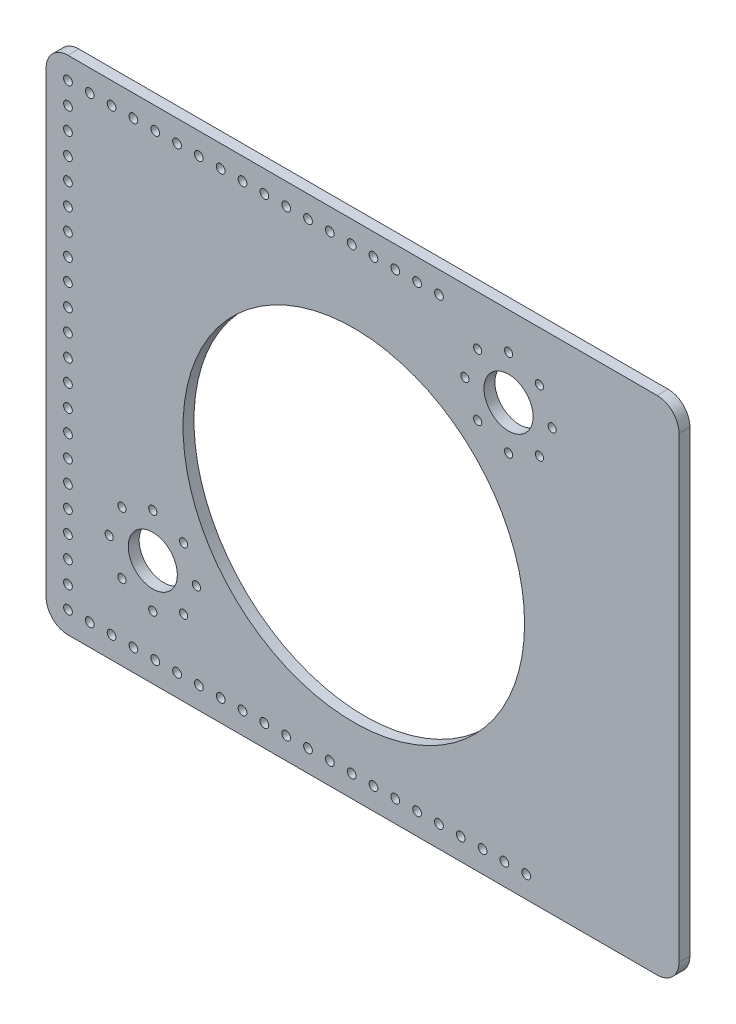
from build123d import *

# Parameters (mm, degrees)
SKETCH1_W           = 368.3
SKETCH1_H           = 292.1
SKETCH1_R           = 99.3775
SKETCH1_R_2         = 2.54
BOSS_EXTRUDE1_DEPTH = 6.35
SKETCH2_R           = 14.2875
SKETCH2_R_2         = 2.38125
CUT_EXTRUDE1_DEPTH  = 471.11447808
FILLET1_R           = 12.7


with BuildPart() as part:
    # Sketch1 → Boss-Extrude1 (new body)
    with BuildSketch(Plane.XY):
        with Locations((184.15, 146.05)):
            Rectangle(SKETCH1_W, SKETCH1_H)
        with Locations((179.07, 138.43)):
            Circle(SKETCH1_R, mode=Mode.SUBTRACT)
        with Locations((12.7, 279.4)):
            Circle(SKETCH1_R_2, mode=Mode.SUBTRACT)
        with Locations((25.4, 279.4)):
            Circle(SKETCH1_R_2, mode=Mode.SUBTRACT)
        with Locations((38.1, 279.4)):
            Circle(SKETCH1_R_2, mode=Mode.SUBTRACT)
        with Locations((50.8, 279.4)):
            Circle(SKETCH1_R_2, mode=Mode.SUBTRACT)
        with Locations((63.5, 279.4)):
            Circle(SKETCH1_R_2, mode=Mode.SUBTRACT)
        with Locations((76.2, 279.4)):
            Circle(SKETCH1_R_2, mode=Mode.SUBTRACT)
        with Locations((88.9, 279.4)):
            Circle(SKETCH1_R_2, mode=Mode.SUBTRACT)
        with Locations((101.6, 279.4)):
            Circle(SKETCH1_R_2, mode=Mode.SUBTRACT)
        with Locations((114.3, 279.4)):
            Circle(SKETCH1_R_2, mode=Mode.SUBTRACT)
        with Locations((127, 279.4)):
            Circle(SKETCH1_R_2, mode=Mode.SUBTRACT)
        with Locations((139.7, 279.4)):
            Circle(SKETCH1_R_2, mode=Mode.SUBTRACT)
        with Locations((152.4, 279.4)):
            Circle(SKETCH1_R_2, mode=Mode.SUBTRACT)
        with Locations((165.1, 279.4)):
            Circle(SKETCH1_R_2, mode=Mode.SUBTRACT)
        with Locations((177.8, 279.4)):
            Circle(SKETCH1_R_2, mode=Mode.SUBTRACT)
        with Locations((190.5, 279.4)):
            Circle(SKETCH1_R_2, mode=Mode.SUBTRACT)
        with Locations((203.2, 279.4)):
            Circle(SKETCH1_R_2, mode=Mode.SUBTRACT)
        with Locations((215.9, 279.4)):
            Circle(SKETCH1_R_2, mode=Mode.SUBTRACT)
        with Locations((228.6, 279.4)):
            Circle(SKETCH1_R_2, mode=Mode.SUBTRACT)
        with Locations((12.7, 266.7)):
            Circle(SKETCH1_R_2, mode=Mode.SUBTRACT)
        with Locations((12.7, 254)):
            Circle(SKETCH1_R_2, mode=Mode.SUBTRACT)
        with Locations((12.7, 241.3)):
            Circle(SKETCH1_R_2, mode=Mode.SUBTRACT)
        with Locations((12.7, 228.6)):
            Circle(SKETCH1_R_2, mode=Mode.SUBTRACT)
        with Locations((12.7, 215.9)):
            Circle(SKETCH1_R_2, mode=Mode.SUBTRACT)
        with Locations((12.7, 203.2)):
            Circle(SKETCH1_R_2, mode=Mode.SUBTRACT)
        with Locations((12.7, 190.5)):
            Circle(SKETCH1_R_2, mode=Mode.SUBTRACT)
        with Locations((12.7, 177.8)):
            Circle(SKETCH1_R_2, mode=Mode.SUBTRACT)
        with Locations((12.7, 165.1)):
            Circle(SKETCH1_R_2, mode=Mode.SUBTRACT)
        with Locations((12.7, 152.4)):
            Circle(SKETCH1_R_2, mode=Mode.SUBTRACT)
        with Locations((12.7, 139.7)):
            Circle(SKETCH1_R_2, mode=Mode.SUBTRACT)
        with Locations((12.7, 127)):
            Circle(SKETCH1_R_2, mode=Mode.SUBTRACT)
        with Locations((12.7, 114.3)):
            Circle(SKETCH1_R_2, mode=Mode.SUBTRACT)
        with Locations((12.7, 101.6)):
            Circle(SKETCH1_R_2, mode=Mode.SUBTRACT)
        with Locations((12.7, 88.9)):
            Circle(SKETCH1_R_2, mode=Mode.SUBTRACT)
        with Locations((12.7, 76.2)):
            Circle(SKETCH1_R_2, mode=Mode.SUBTRACT)
        with Locations((12.7, 63.5)):
            Circle(SKETCH1_R_2, mode=Mode.SUBTRACT)
        with Locations((12.7, 50.8)):
            Circle(SKETCH1_R_2, mode=Mode.SUBTRACT)
        with Locations((12.7, 38.1)):
            Circle(SKETCH1_R_2, mode=Mode.SUBTRACT)
        with Locations((12.7, 25.4)):
            Circle(SKETCH1_R_2, mode=Mode.SUBTRACT)
        with Locations((12.7, 12.7)):
            Circle(SKETCH1_R_2, mode=Mode.SUBTRACT)
        with Locations((25.4, 12.7)):
            Circle(SKETCH1_R_2, mode=Mode.SUBTRACT)
        with Locations((38.1, 12.7)):
            Circle(SKETCH1_R_2, mode=Mode.SUBTRACT)
        with Locations((50.8, 12.7)):
            Circle(SKETCH1_R_2, mode=Mode.SUBTRACT)
        with Locations((63.5, 12.7)):
            Circle(SKETCH1_R_2, mode=Mode.SUBTRACT)
        with Locations((76.2, 12.7)):
            Circle(SKETCH1_R_2, mode=Mode.SUBTRACT)
        with Locations((88.9, 12.7)):
            Circle(SKETCH1_R_2, mode=Mode.SUBTRACT)
        with Locations((101.6, 12.7)):
            Circle(SKETCH1_R_2, mode=Mode.SUBTRACT)
        with Locations((114.3, 12.7)):
            Circle(SKETCH1_R_2, mode=Mode.SUBTRACT)
        with Locations((127, 12.7)):
            Circle(SKETCH1_R_2, mode=Mode.SUBTRACT)
        with Locations((139.7, 12.7)):
            Circle(SKETCH1_R_2, mode=Mode.SUBTRACT)
        with Locations((152.4, 12.7)):
            Circle(SKETCH1_R_2, mode=Mode.SUBTRACT)
        with Locations((165.1, 12.7)):
            Circle(SKETCH1_R_2, mode=Mode.SUBTRACT)
        with Locations((177.8, 12.7)):
            Circle(SKETCH1_R_2, mode=Mode.SUBTRACT)
        with Locations((190.5, 12.7)):
            Circle(SKETCH1_R_2, mode=Mode.SUBTRACT)
        with Locations((203.2, 12.7)):
            Circle(SKETCH1_R_2, mode=Mode.SUBTRACT)
        with Locations((215.9, 12.7)):
            Circle(SKETCH1_R_2, mode=Mode.SUBTRACT)
        with Locations((228.6, 12.7)):
            Circle(SKETCH1_R_2, mode=Mode.SUBTRACT)
        with Locations((241.3, 12.7)):
            Circle(SKETCH1_R_2, mode=Mode.SUBTRACT)
        with Locations((254, 12.7)):
            Circle(SKETCH1_R_2, mode=Mode.SUBTRACT)
        with Locations((266.7, 12.7)):
            Circle(SKETCH1_R_2, mode=Mode.SUBTRACT)
        with Locations((279.4, 12.7)):
            Circle(SKETCH1_R_2, mode=Mode.SUBTRACT)
    extrude(amount=BOSS_EXTRUDE1_DEPTH)

    # Sketch2 → Cut-Extrude1 (cut, through all)
    with BuildSketch(Plane.XY.offset(6.35)):
        with Locations((62.079722251, 62.079722251)):
            Circle(SKETCH2_R)
        with Locations((269.10870269, 245.243491741)):
            Circle(SKETCH2_R)
        with Locations((62.079722251, 87.479722251)):
            Circle(SKETCH2_R_2)
        with Locations((80.040234493, 80.040234493)):
            Circle(SKETCH2_R_2)
        with Locations((87.479722251, 62.079722251)):
            Circle(SKETCH2_R_2)
        with Locations((80.040234493, 44.119210009)):
            Circle(SKETCH2_R_2)
        with Locations((62.079722251, 36.679722251)):
            Circle(SKETCH2_R_2)
        with Locations((44.119210009, 44.119210009)):
            Circle(SKETCH2_R_2)
        with Locations((36.679722251, 62.079722251)):
            Circle(SKETCH2_R_2)
        with Locations((44.119210009, 80.040234493)):
            Circle(SKETCH2_R_2)
        with Locations((269.10870269, 270.643491741)):
            Circle(SKETCH2_R_2)
        with Locations((287.069214932, 263.204003983)):
            Circle(SKETCH2_R_2)
        with Locations((294.50870269, 245.243491741)):
            Circle(SKETCH2_R_2)
        with Locations((287.069214932, 227.282979499)):
            Circle(SKETCH2_R_2)
        with Locations((269.10870269, 219.843491741)):
            Circle(SKETCH2_R_2)
        with Locations((251.148190448, 227.282979499)):
            Circle(SKETCH2_R_2)
        with Locations((243.70870269, 245.243491741)):
            Circle(SKETCH2_R_2)
        with Locations((251.148190448, 263.204003983)):
            Circle(SKETCH2_R_2)
    extrude(amount=-CUT_EXTRUDE1_DEPTH, mode=Mode.SUBTRACT)

    # Fillet1
    fillet1_edges = [part.edges().sort_by_distance(p)[0] for p in [
        (0, 0, 3.175),
        (0, 292.1, 3.175),
        (368.3, 292.1, 3.175),
        (368.3, 0, 3.175),
    ]]
    fillet(fillet1_edges, radius=FILLET1_R)


solid = part.part
